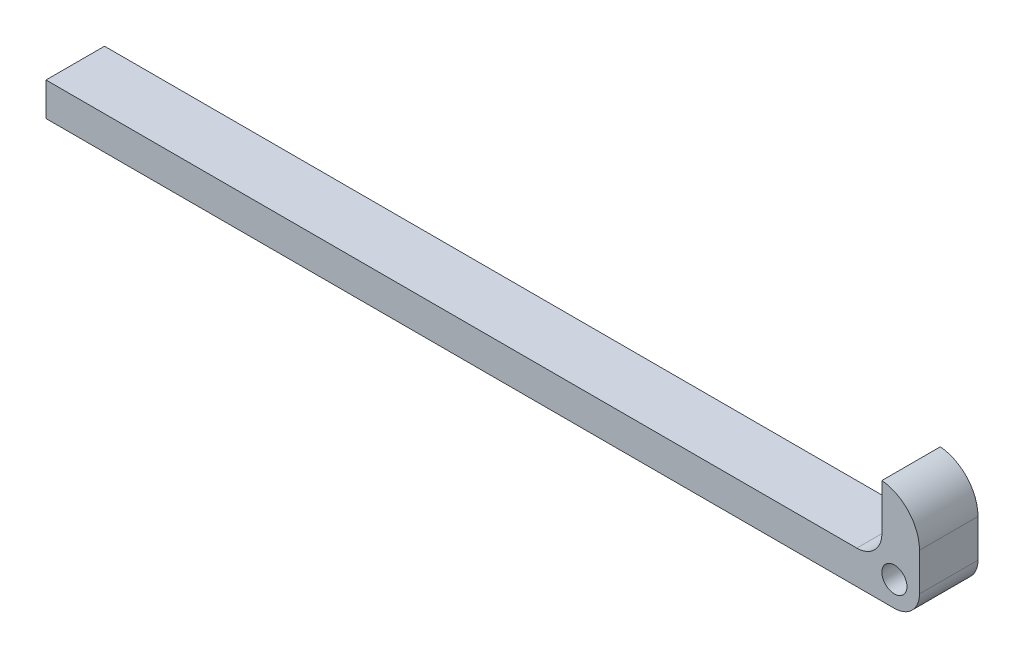
from build123d import *

# Parameters (mm, degrees)
EXTRUDE_1_DEPTH          = 5
EXTRUDE_1_DEPTH_BACK     = 7.5
SKETCH_1_W               = 4.5
SKETCH_1_H               = 7
SKETCH_2_W               = 4.5
SKETCH_2_H               = 7
EXTRUDE_2_DEPTH          = 4
FILLET_1_R               = 3
SKETCH_3_W               = 7
SKETCH_3_H               = 4
EXTRUDE_3_DEPTH          = 100
FILLET_2_R               = 5
FILLET_3_R               = 3
CUT_EXTRUDE_1_DEPTH      = 122.436842092
CUT_EXTRUDE_1_DEPTH_BACK = 122.436842092
SKETCH_6_R               = 1.5


with BuildPart() as part:
    # Эскиз1 → Бобышка-Вытянуть1 (new, two sides: drawn at the far end of the back side and taken through both)
    with BuildSketch(Plane(origin=(0, 36.697201552, 0), x_dir=(1, 0, 0), z_dir=(0, 1, 0)).offset(-EXTRUDE_1_DEPTH_BACK)):
        with Locations((-11.75, 0)):
            Rectangle(SKETCH_1_W, SKETCH_1_H)
    extrude(amount=EXTRUDE_1_DEPTH + EXTRUDE_1_DEPTH_BACK)

    # Эскиз2 → Бобышка-Вытянуть2 (add)
    with BuildSketch(Plane.XZ.offset(-29.197201552)):
        with Locations((-11.75, 0)):
            Rectangle(SKETCH_2_W, SKETCH_2_H)
    extrude(amount=-EXTRUDE_2_DEPTH)

    # Скругление1
    fillet_1_edges = [part.edges().sort_by_distance(p)[0] for p in [
        (-9.5, 29.197201552, 0),
    ]]
    fillet(fillet_1_edges, radius=FILLET_1_R)

    # Эскиз3 → Бобышка-Вытянуть3 (add)
    with BuildSketch(Plane.ZY.offset(14)):
        with Locations((0, 31.197201552)):
            Rectangle(SKETCH_3_W, SKETCH_3_H)
    extrude(amount=EXTRUDE_3_DEPTH)

    # Скругление2
    # the kernel refuses this fillet: 5 mm, written as the material it takes off along each edge
    with BuildSketch(Plane(origin=(-9.5, 41.697201552, 15.937342964), x_dir=(-1, 0, 0), z_dir=(0, 0, -1))) as fillet_2_piece_1:
        with BuildLine():
            CenterArc((5, -4.974937186), FILLET_2_R, 95.739170477, 84.260829523)
            Line((0, -4.974937186), (-0.1, -4.974937186))
            Line((-0.1, -4.974937186), (-0.1, 0))
            Line((-0.1, 0), (0, 0.1))
            ThreePointArc((0, 0.1), (2.25, 0.1), (4.49, 0.099498744))
            Line((4.49, 0.099498744), (4.5, 0))
        make_face()
    extrude(amount=31.874685928, mode=Mode.SUBTRACT)

    # Скругление3
    fillet_3_edges = [part.edges().sort_by_distance(p)[0] for p in [
        (-14, 33.197201552, 0),
    ]]
    fillet(fillet_3_edges, radius=FILLET_3_R)

    # Эскиз6 → Вырез-Вытянуть1 (cut, two sides: drawn at the far end of the back side and taken through both)
    with BuildSketch(Plane.XY.offset(-CUT_EXTRUDE_1_DEPTH_BACK)):
        with Locations((-12.5, 32.197201552)):
            Circle(SKETCH_6_R)
    extrude(amount=CUT_EXTRUDE_1_DEPTH + CUT_EXTRUDE_1_DEPTH_BACK, mode=Mode.SUBTRACT)


solid = part.part
